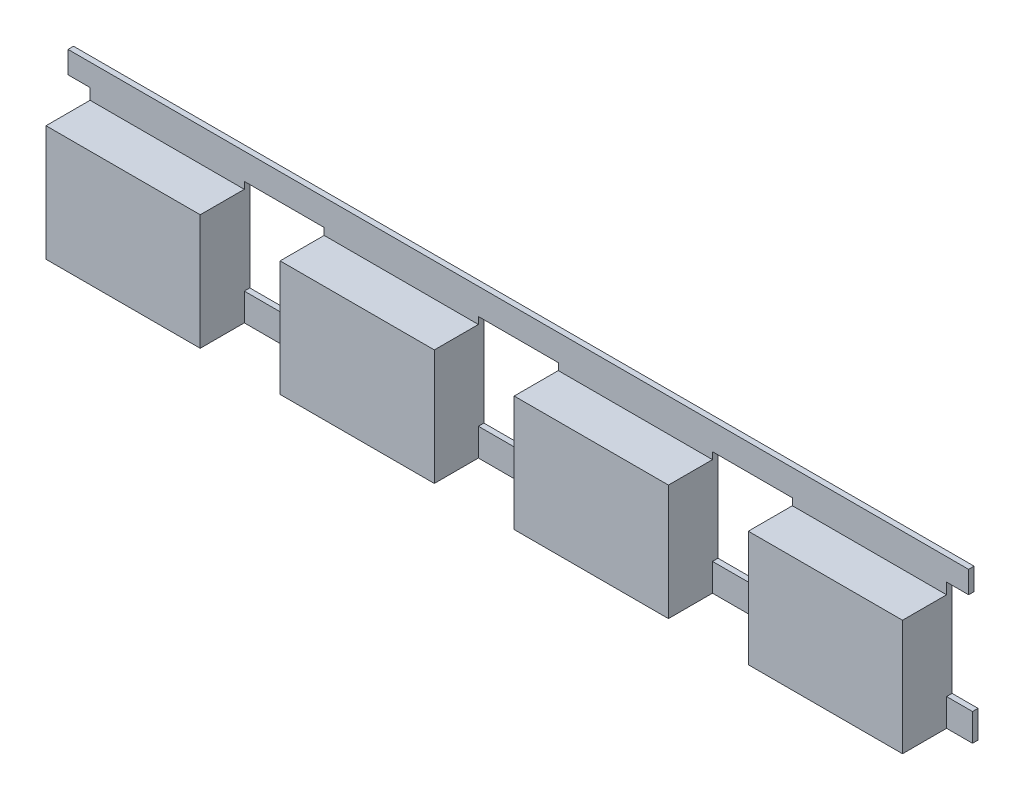
from build123d import *

# Parameters (mm, degrees)
SKETCH_1_W             = 5.6
SKETCH_1_H             = 4.2
EXTRUDE_1_DEPTH        = 1.4
SKETCH_3_W             = 31.1
SKETCH_3_H             = 1.5
EXTRUDE_2_DEPTH        = 0.2
PATTERN_LINEAR_1_COUNT = 4
PATTERN_LINEAR_1_PITCH = 8.5
SKETCH_4_W             = 2.9
SKETCH_4_H             = 1.1
CUT_EXTRUDE_1_DEPTH    = 0.2
SKETCH_5_W             = 0.2
SKETCH_5_H             = 0.8
EXTRUDE_3_DEPTH        = 0.8
SKETCH_6_W             = 0.2
SKETCH_6_H             = 0.8
EXTRUDE_4_DEPTH        = 0.8
SKETCH_7_W             = 32.884134448
SKETCH_7_H             = 1
EXTRUDE_5_DEPTH        = 0.2
CUT_EXTRUDE_START      = -0.6
SKETCH_8_W             = 4.4
SKETCH_8_H             = 3
CUT_EXTRUDE_2_DEPTH    = 1
SKETCH_9_W             = 5.6
SKETCH_9_H             = 4.2
EXTRUDE_6_DEPTH        = 0.4


with BuildPart() as part:
    # Эскиз1 → Бобышка-Вытянуть1 (new body)
    with BuildSketch(Plane.XY):
        Rectangle(SKETCH_1_W, SKETCH_1_H)
    extrude_1 = extrude(amount=EXTRUDE_1_DEPTH)

    # Эскиз3 → Бобышка-Вытянуть2 (add)
    with BuildSketch(Plane(origin=(0, 0, 0), x_dir=(-1, 0, 0), z_dir=(0, 0, -1))):
        with Locations((-12.75, 2.55)):
            Rectangle(SKETCH_3_W, SKETCH_3_H)
    extrude(amount=-EXTRUDE_2_DEPTH)

    # Линейный массив1: Бобышка-Вытянуть1 ×4
    with Locations(*[(i * PATTERN_LINEAR_1_PITCH, 0, 0) for i in range(1, PATTERN_LINEAR_1_COUNT)]):
        add(extrude_1)

    # Эскиз4 → Вырез-Вытянуть1 (cut)
    with BuildSketch(Plane(origin=(0, 0, 0), x_dir=(-1, 0, 0), z_dir=(0, 0, -1))):
        with Locations((-21.25, 1.8)):
            Rectangle(SKETCH_4_W, SKETCH_4_H)
        with Locations((-12.75, 1.8)):
            Rectangle(SKETCH_4_W, SKETCH_4_H)
        with Locations((-4.25, 1.8)):
            Rectangle(SKETCH_4_W, SKETCH_4_H)
    extrude(amount=-CUT_EXTRUDE_1_DEPTH, mode=Mode.SUBTRACT)

    # Эскиз5 → Бобышка-Вытянуть3 (add)
    with BuildSketch(Plane(origin=(28.3, 0, 0), x_dir=(0, 0, -1), z_dir=(1, 0, 0))):
        with Locations((-0.1, 2.9)):
            Rectangle(SKETCH_5_W, SKETCH_5_H)
    extrude(amount=EXTRUDE_3_DEPTH)

    # Эскиз6 → Бобышка-Вытянуть4 (add)
    with BuildSketch(Plane.ZY.offset(2.8)):
        with Locations((0.1, 2.9)):
            Rectangle(SKETCH_6_W, SKETCH_6_H)
    extrude(amount=EXTRUDE_4_DEPTH)

    # Эскиз7 → Бобышка-Вытянуть5 (add)
    with BuildSketch(Plane(origin=(0, 0, 0), x_dir=(-1, 0, 0), z_dir=(0, 0, -1))):
        with Locations((-12.798406479, -1.6)):
            Rectangle(SKETCH_7_W, SKETCH_7_H)
    extrude(amount=-EXTRUDE_5_DEPTH)

    # Эскиз8 → Вырез-Вытянуть2 (cut)
    with BuildSketch(Plane.XY.offset(1.4).offset(CUT_EXTRUDE_START)):
        Rectangle(SKETCH_8_W, SKETCH_8_H)
        with Locations((8.5, 0)):
            Rectangle(SKETCH_8_W, SKETCH_8_H)
        with Locations((17, 0)):
            Rectangle(SKETCH_8_W, SKETCH_8_H)
        with Locations((25.5, 0)):
            Rectangle(SKETCH_8_W, SKETCH_8_H)
    extrude(amount=-CUT_EXTRUDE_2_DEPTH, mode=Mode.SUBTRACT)

    # Эскиз9 → Бобышка-Вытянуть6 (add)
    with BuildSketch(Plane.XY.offset(1.4)):
        Rectangle(SKETCH_9_W, SKETCH_9_H)
        with Locations((8.5, 0)):
            Rectangle(SKETCH_9_W, SKETCH_9_H)
        with Locations((17, 0)):
            Rectangle(SKETCH_9_W, SKETCH_9_H)
        with Locations((25.5, 0)):
            Rectangle(SKETCH_9_W, SKETCH_9_H)
    extrude(amount=EXTRUDE_6_DEPTH)


solid = part.part
